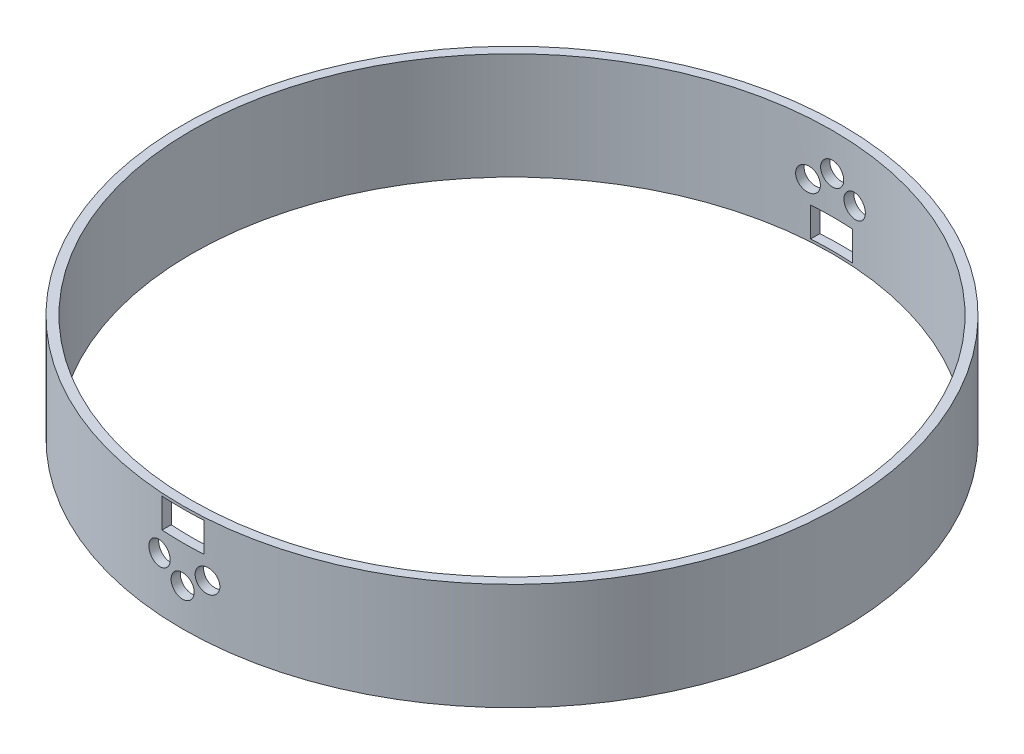
from build123d import *

# Parameters (mm, degrees)
SKETCH1_R               = 78.359
SKETCH1_R_2             = 76.1746
BOSS_EXTRUDE1_DEPTH     = 12.7
CUT_SWEEP1_START        = -78.35900006
CUT_SWEEP1_OUTLINE_R    = 2.749999961
CUT_SWEEP1_DEPTH        = 2.234055593
MIRROR2_START           = -78.35900006
MIRROR2_COPY_1_SKETCH_R = 2.749999961
MIRROR2_COPY_1_DEPTH    = 2.234055593
SKETCH18_R              = 2.749999961
SKETCH18_W              = 10.000000066
SKETCH18_H              = 6.99999997
CUT_EXTRUDE1_DEPTH      = 112.54172222
SKETCH18_3_R            = 2.749999961
SKETCH18_3_W            = 10.000000066
SKETCH18_3_H            = 6.99999997
CUT_EXTRUDE2_DEPTH      = 112.541722222


# Read off the part's stored shape, not the designer's step: Cut-Sweep1
with BuildPart() as part:
    # Sketch1 → Boss-Extrude1 (new, symmetric)
    with BuildSketch(Plane(origin=(0, 0, 0), x_dir=(1, 0, 0), z_dir=(0, 1, 0))):
        with Locations(Location((0, 0, 0), (0, 0, 270))):
            Circle(SKETCH1_R)
        with Locations(Location((0, 0, 0), (0, 0, 270))):
            Circle(SKETCH1_R_2, mode=Mode.SUBTRACT)
    extrude(amount=BOSS_EXTRUDE1_DEPTH, both=True)

    # Cut-Sweep1 outline → Cut-Sweep1 (cut)
    with BuildSketch(Plane(origin=(0, 0, 0), x_dir=(0.99734525831366, 0, -0.0728178255598082), z_dir=(0.0728178255598082, 0, 0.99734525831366)).offset(CUT_SWEEP1_START)):
        Circle(CUT_SWEEP1_OUTLINE_R)
    cut_sweep1 = extrude(amount=CUT_SWEEP1_DEPTH, mode=Mode.SUBTRACT)

    # Mirror1: Cut-Sweep1 across plane
    add(cut_sweep1.mirror(Plane(origin=(0, 0, 0), x_dir=(0, 0, 1), z_dir=(1, 0, 0))), mode=Mode.SUBTRACT)

    # Mirror2: Cut-Sweep1 across plane
    add(cut_sweep1.mirror(Plane.XY), mode=Mode.SUBTRACT)

    # Mirror2 copy 1 sketch → Mirror2 copy 1 (cut)
    with BuildSketch(Plane(origin=(0, 0, 0), x_dir=(-0.99734525831366, 0, 0.0728178255598082), z_dir=(-0.0728178255598082, 0, -0.99734525831366)).offset(MIRROR2_START)):
        Circle(MIRROR2_COPY_1_SKETCH_R)
    extrude(amount=MIRROR2_COPY_1_DEPTH, mode=Mode.SUBTRACT)

    # Sketch18 → Cut-Extrude1 (cut, through all)
    with BuildSketch(Plane.XY):
        with Locations(Location((0, 3.81, 0), (0, 0, 90))):
            Circle(SKETCH18_R)
        with Locations((0, -8.579999985)):
            Rectangle(SKETCH18_W, SKETCH18_H)
    extrude(amount=-CUT_EXTRUDE1_DEPTH, mode=Mode.SUBTRACT)

    # Sketch18<3> → Cut-Extrude2 (cut, through all)
    with BuildSketch(Plane.XY):
        with Locations(Location((0, -3.81, 0), (0, 0, 269.999999951))):
            Circle(SKETCH18_3_R)
        with Locations((0, 8.579999985)):
            Rectangle(SKETCH18_3_W, SKETCH18_3_H)
    extrude(amount=CUT_EXTRUDE2_DEPTH, mode=Mode.SUBTRACT)


solid = part.part
